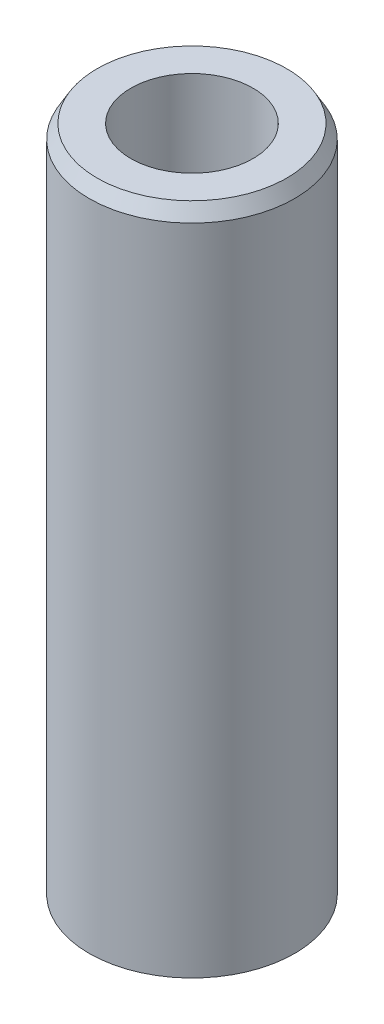
from build123d import *
from OCP.BRepFilletAPI import BRepFilletAPI_MakeChamfer

# Parameters (mm, degrees)
SKETCH1_R           = 17.5
BOSS_EXTRUDE1_DEPTH = 115.021167094
SKETCH2_R           = 10.403261138
CUT_EXTRUDE1_DEPTH  = 118.653596969
CHAMFER1_SIZE       = 2.341266742
CHAMFER1_SIZE2      = 1.351730984


with BuildPart() as part:
    # Sketch1 → Boss-Extrude1 (new body)
    with BuildSketch(Plane(origin=(0, 0, 0), x_dir=(1, 0, 0), z_dir=(0, 1, 0))):
        Circle(SKETCH1_R)
    extrude(amount=BOSS_EXTRUDE1_DEPTH)

    # Sketch2 → Cut-Extrude1 (cut, through all)
    with BuildSketch(Plane(origin=(0, 0, 0), x_dir=(1, 0, 0), z_dir=(0, 1, 0))):
        Circle(SKETCH2_R)
    extrude(amount=CUT_EXTRUDE1_DEPTH, mode=Mode.SUBTRACT)

    # Chamfer1: one chamfer whose edges measure the first distance from different faces: ONE call of the kernel's chamfer builder (chamfer() names one face for all edges)
    chamfer1_edges_1 = [part.edges().sort_by_distance(p)[0] for p in [
        (-17.5, 115.021167094, 0),
    ]]
    chamfer1_side_1 = [part.faces().sort_by_distance(p)[0] for p in [
        (-17.5, 57.510583547, 0),
    ]]
    chamfer1_edges_2 = [part.edges().sort_by_distance(p)[0] for p in [
        (-17.5, 0, 0),
    ]]
    chamfer1_side_2 = [part.faces().sort_by_distance(p)[0] for p in [
        (-17.005025253, 0, 0),
    ]]
    chamfer1 = BRepFilletAPI_MakeChamfer(part.part.solid().wrapped)
    for e in chamfer1_edges_1:
        chamfer1.Add(CHAMFER1_SIZE, CHAMFER1_SIZE2, e.wrapped, chamfer1_side_1[0].wrapped)  # the first distance lies on this face
    for e in chamfer1_edges_2:
        chamfer1.Add(CHAMFER1_SIZE, CHAMFER1_SIZE2, e.wrapped, chamfer1_side_2[0].wrapped)  # the first distance lies on this face
    add(Compound.cast(chamfer1.Shape()), mode=Mode.REPLACE)


solid = part.part
